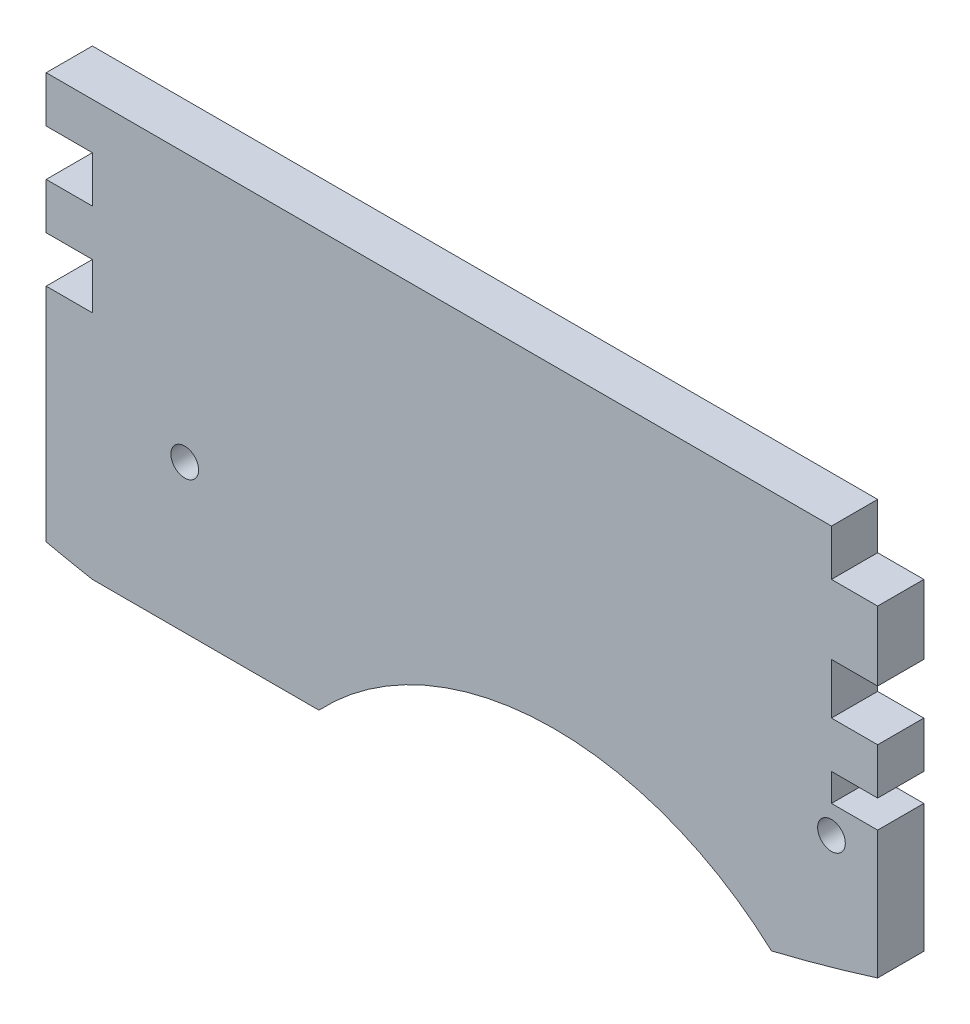
from build123d import *

# Parameters (mm, degrees)
ESQUISSE1_R             = 1.5
BOSS_EXTRU_1_DEPTH      = 5
ENL_V_MAT_EXTRU_1_DEPTH = 10


with BuildPart() as part:
    # Esquisse1 → Boss.-Extru.1 (new body)
    with BuildSketch(Plane.XY):
        with BuildLine():
            Line((0, 24.989748411), (0, 0))
            Line((0, 0), (29.524521594, 0))
            ThreePointArc((29.524521594, 0), (55, 11), (80.475478406, 0))
            Line((80.475478406, 0), (90, 0))
            Line((90, 0), (90, 19))
            Line((90, 19), (85, 19))
            Line((85, 19), (85, 22))
            Line((85, 22), (90, 22))
            Line((90, 22), (90, 27))
            Line((90, 27), (85, 27))
            Line((85, 27), (85, 32.5))
            Line((85, 32.5), (90, 32.5))
            Line((90, 32.5), (90, 40))
            Line((90, 40), (85, 40))
            Line((85, 40), (85, 45))
            Line((85, 45), (0, 45))
            Line((0, 45), (0, 39.997437103))
            Line((0, 39.997437103), (5, 39.997437103))
            Line((5, 39.997437103), (5, 34.994874205))
            Line((5, 34.994874205), (0, 34.994874205))
            Line((0, 34.994874205), (0, 29.992311308))
            Line((0, 29.992311308), (5, 29.992311308))
            Line((5, 29.992311308), (5, 24.989748411))
            Line((5, 24.989748411), (0, 24.989748411))
        make_face()
        with Locations((15, 16)):
            Circle(ESQUISSE1_R, mode=Mode.SUBTRACT)
        with Locations((85, 16)):
            Circle(ESQUISSE1_R, mode=Mode.SUBTRACT)
    extrude(amount=BOSS_EXTRU_1_DEPTH)

    # Esquisse2 → Enlèv. mat.-Extru.1 (cut)
    with BuildSketch(Plane.XY.offset(5)):
        with BuildLine():
            Line((159.184071577, 46.45866906), (172.198991612, 38.236434318))
            ThreePointArc((172.198991612, 38.236434318), (54.400154904, -17.225712878), (-71.445596942, 16.172826663))
            Line((-71.445596942, 16.172826663), (-46.909551046, 18.57339276))
            ThreePointArc((-46.909551046, 18.57339276), (60.728909835, -1.419788244), (159.184071577, 46.45866906))
        make_face()
    extrude(amount=-ENL_V_MAT_EXTRU_1_DEPTH, mode=Mode.SUBTRACT)


solid = part.part
